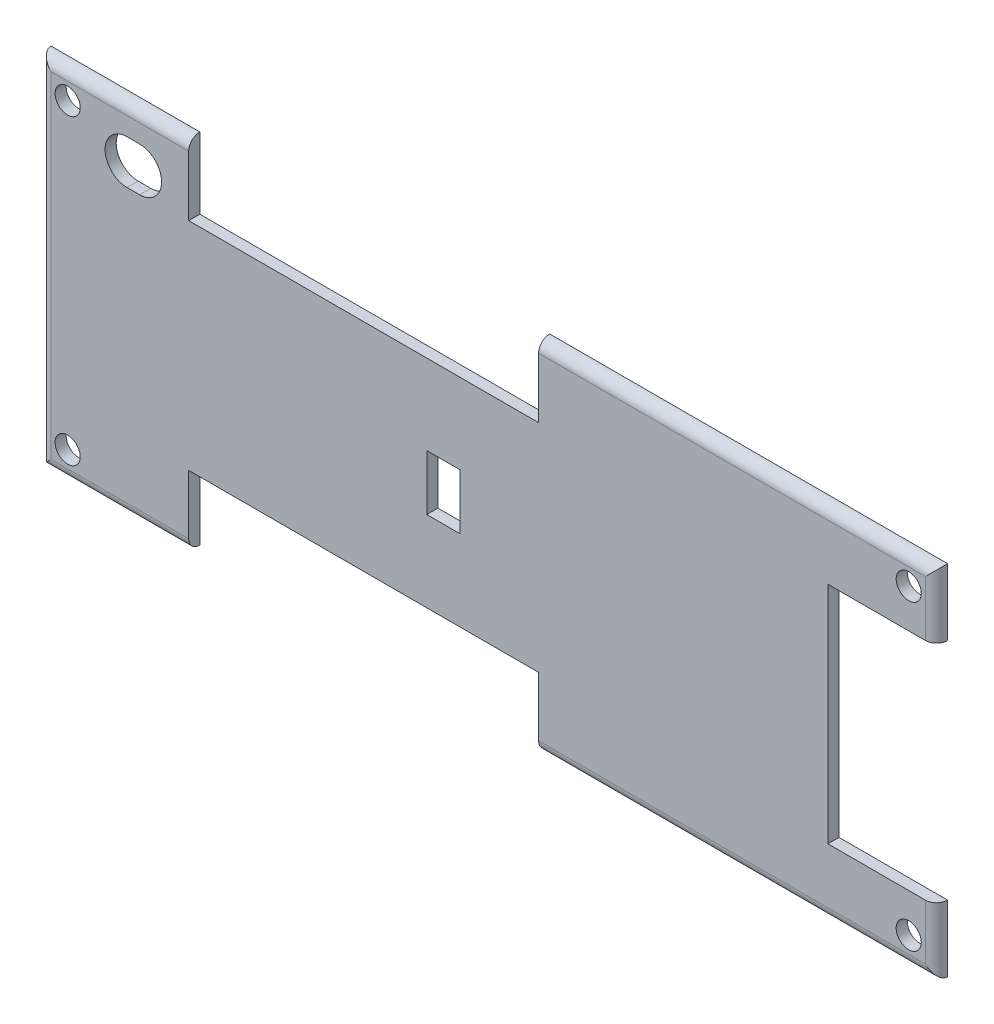
from build123d import *

# Parameters (mm, degrees)
SKETCH1_R           = 1.1303
SKETCH1_W           = 2.983921929
SKETCH1_H           = 4.98
BOSS_EXTRUDE1_DEPTH = 1
FILLET1_R           = 1


with BuildPart() as part:
    # Sketch1 → Boss-Extrude1 (new body)
    with BuildSketch(Plane.XY):
        Polygon((-26.65, 16.1), (-40.032188793, 16.1), (-40.032188793, -16.08), (-26.65, -16.08), (-26.65, -9.752186355), (4.81, -9.752186355), (4.81, -16.08), (40.590666929, -16.08), (40.590666929, -10.095824831), (30.822198497, -10.095824831), (30.822198497, 10.115824831), (40.590666929, 10.115824831), (40.590666929, 16.1), (4.81, 16.1), (4.81, 9.693936617), (-26.65, 9.693936617), align=None)
        with Locations((-37.532188793, 13.6)):
            Circle(SKETCH1_R, mode=Mode.SUBTRACT)
        with Locations((-37.532188793, -13.58)):
            Circle(SKETCH1_R, mode=Mode.SUBTRACT)
        with Locations((38.090666929, 13.6)):
            Circle(SKETCH1_R, mode=Mode.SUBTRACT)
        with Locations((38.090666929, -13.58)):
            Circle(SKETCH1_R, mode=Mode.SUBTRACT)
        with Locations((-3.751960965, 0)):
            Rectangle(SKETCH1_W, SKETCH1_H, mode=Mode.SUBTRACT)
        with BuildLine():
            Line((-32.190591627, 13.451742973), (-31.061789136, 13.451742973))
            ThreePointArc((-31.061789136, 13.451742973), (-29.086350608, 11.476304445), (-31.061789136, 9.500865917))
            Line((-31.061789136, 9.500865917), (-32.190591627, 9.500865917))
            ThreePointArc((-32.190591627, 9.500865917), (-34.166030155, 11.476304445), (-32.190591627, 13.451742973))
        make_face(mode=Mode.SUBTRACT)
    extrude(amount=BOSS_EXTRUDE1_DEPTH)

    # Fillet1
    fillet1_edges = [part.edges().sort_by_distance(p)[0] for p in [
        (40.590666929, 13.107912416, 1),
        (22.700333464, 16.1, 1),
        (40.590666929, -13.087912416, 1),
        (22.700333464, -16.08, 1),
        (-33.341094396, -16.08, 1),
        (-40.032188793, 0.01, 1),
        (-33.341094396, 16.1, 1),
    ]]
    fillet(fillet1_edges, radius=FILLET1_R - 0.0001)  # a hair under: the kernel refuses the full size


solid = part.part
